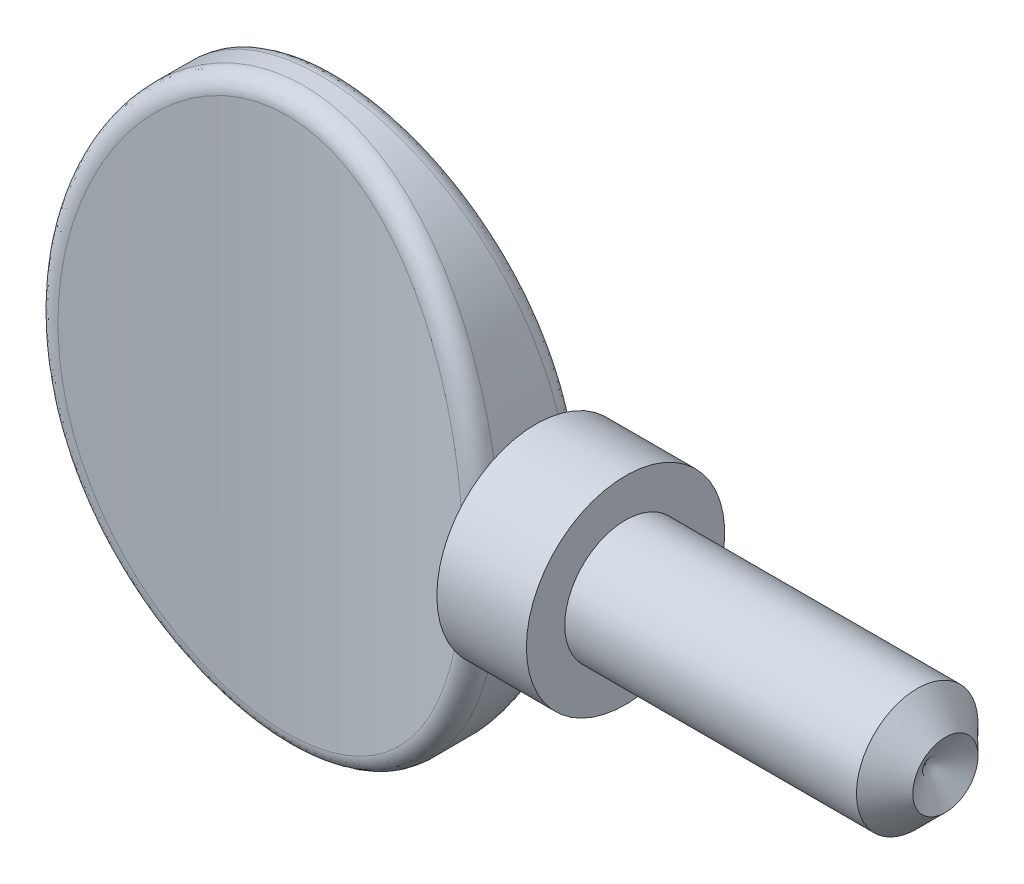
from build123d import *

# Parameters (mm, degrees)
SKETCH1_RX              = 11.303
SKETCH1_RY              = 8.889999999999999
EXTRUDE1_DEPTH          = 2.286
CUT_EXTRUDE1_DEPTH      = 15.560759080487529
CUT_EXTRUDE1_DEPTH_BACK = 15.560759080487529
SKETCH2_OUTSIDE_W       = 25.603999999999996
SKETCH2_OUTSIDE_H       = 12.396
FILLET3_R               = 0.6773333333333333


with BuildPart() as part:
    # Sketch1 → Extrude1 (new, symmetric)
    with BuildSketch(Plane.XY):
        with Locations(Location((0, 0), (0, 0, 90))):
            Ellipse(SKETCH1_RX, SKETCH1_RY)
    extrude(amount=EXTRUDE1_DEPTH, both=True)

    # Sketch2 outside → Cut-Extrude1 (cut, two sides: drawn at the far end of the back side and taken through both)
    with BuildSketch(Plane(origin=(0, 0, 0), x_dir=(1, 0, 0), z_dir=(0, 1, 0)).offset(-CUT_EXTRUDE1_DEPTH_BACK)):
        Rectangle(SKETCH2_OUTSIDE_W, SKETCH2_OUTSIDE_H)
        with BuildLine():
            Line((-8.889999999999999, 2.286), (-8.889999999999999, -2.286))
            ThreePointArc((-8.889999999999999, -2.286), (1.94e-15, -1.0159999999999982), (8.889999999999999, -2.286))
            Line((8.889999999999999, -2.286), (8.889999999999999, 2.286))
            ThreePointArc((8.889999999999999, 2.286), (1.94e-15, 1.0159999999999982), (-8.889999999999999, 2.286))
        make_face(mode=Mode.SUBTRACT)
    extrude(amount=CUT_EXTRUDE1_DEPTH + CUT_EXTRUDE1_DEPTH_BACK, mode=Mode.SUBTRACT)

    # Fillet3
    fillet3_edges = [part.edges().sort_by_distance(p)[0] for p in [
        (-6.499256061e-08, -11.302999999991183, 1.0159999999964504),
        (8.835220095e-08, -11.302999999991183, -1.0159999999964522),
    ]]
    fillet(fillet3_edges, radius=FILLET3_R)

    # Sketch3 → Revolve1 (revolve)
    with BuildSketch(Plane(origin=(0, 0, 0), x_dir=(1, 0, 0), z_dir=(0, 1, 0))):
        with BuildLine():
            Line((12.445999999999996, 3.9369999999999994), (12.445999999999996, 2.413))
            Line((12.445999999999996, 2.413), (24.028399999999984, 2.413))
            Line((24.028399999999984, 2.413), (25.14599999999999, 1.2953999999999999))
            Line((25.14599999999999, 1.2953999999999999), (24.367645154111685, 0))
            Line((24.367645154111685, 0), (7.236423048052516, 0))
            Line((7.236423048052516, 0), (7.236423048052516, 1.8516557328217895))
            ThreePointArc((7.236423048052516, 1.8516557328217895), (8.426438076724871, 2.6063068114075874), (8.889999999999999, 3.9370000000000003))
            Line((8.889999999999999, 3.9370000000000003), (12.445999999999996, 3.9369999999999994))
        make_face()
    revolve(axis=Axis((0, 0, 0), (1, 0, 0)))


solid = part.part
